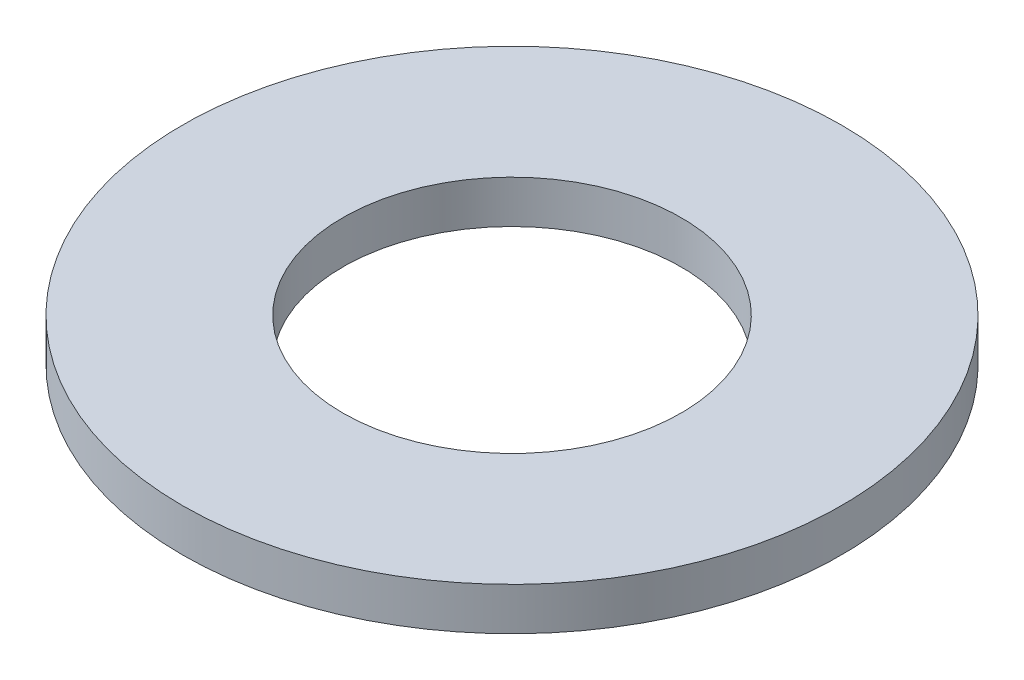
from build123d import *

# Parameters (mm, degrees)
SKETCH1_R           = 92.5
BOSS_EXTRUDE1_DEPTH = 12
SKETCH2_R           = 47.5
CUT_EXTRUDE1_DEPTH  = 132.363998112


with BuildPart() as part:
    # Sketch1 → Boss-Extrude1 (new body)
    with BuildSketch(Plane(origin=(0, 0, 0), x_dir=(1, 0, 0), z_dir=(0, 1, 0))):
        Circle(SKETCH1_R)
    extrude(amount=BOSS_EXTRUDE1_DEPTH)

    # Sketch2 → Cut-Extrude1 (cut, through all)
    with BuildSketch(Plane(origin=(0, 0, 0), x_dir=(1, 0, 0), z_dir=(0, 1, 0))):
        Circle(SKETCH2_R)
    extrude(amount=CUT_EXTRUDE1_DEPTH, mode=Mode.SUBTRACT)


solid = part.part
